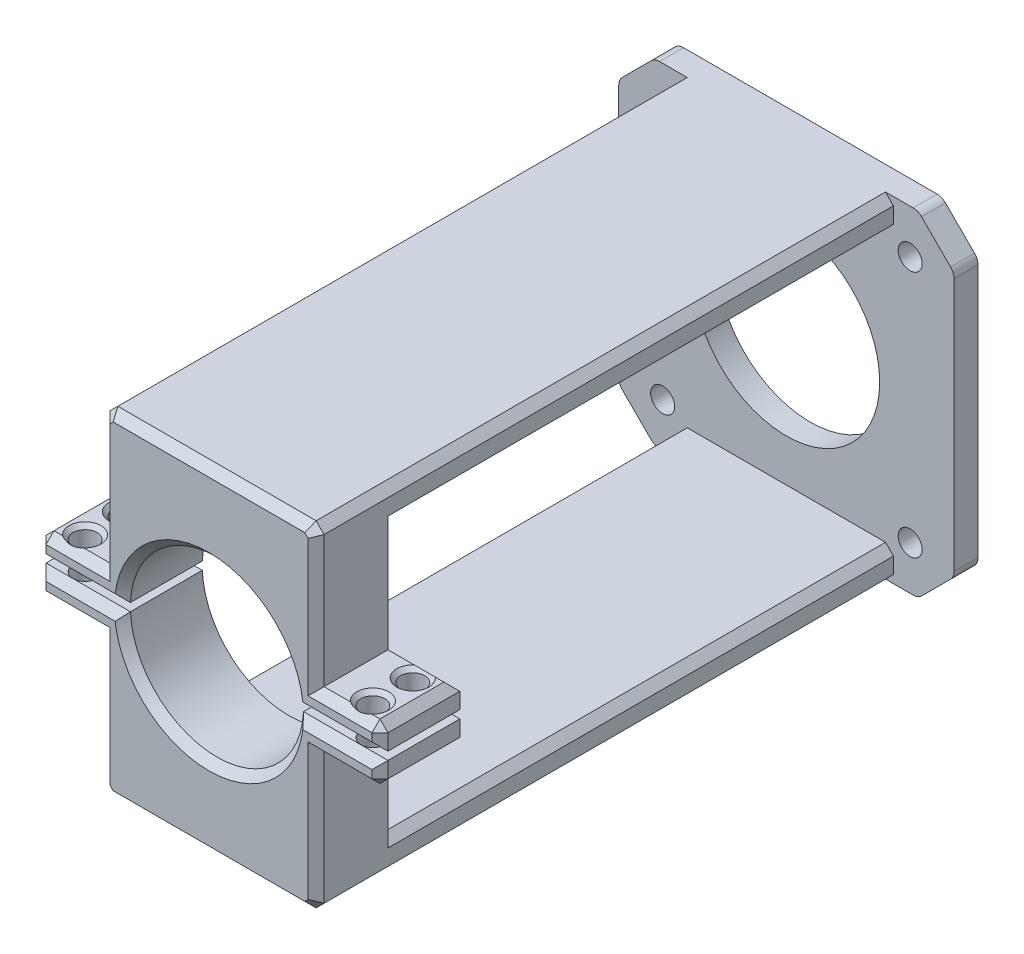
from build123d import *

# Parameters (mm, degrees)
SKETCH1_R                = 1.5
SKETCH1_R_2              = 11.683085131
BOSS_EXTRUDE1_DEPTH      = 3
SKETCH2_W                = 26.83266495
SKETCH2_H                = 4
BOSS_EXTRUDE2_DEPTH      = 70.321471268
BOSS_EXTRUDE3_DEPTH      = 2
BOSS_EXTRUDE3_DEPTH_BACK = 8
SKETCH4_R                = 1.5
CUT_EXTRUDE1_DEPTH       = 20
CHAMFER1_SIZE            = 1
CHAMFER2_SIZE            = 1
CHAMFER3_SIZE            = 1
CHAMFER4_SIZE            = 0.5


# Some blends are built 0.0001 mm under size
with BuildPart() as part:
    # Sketch1 → Boss-Extrude1 (new body)
    with BuildSketch(Plane.XY):
        with BuildLine():
            Line((20.560660172, 16.939339828), (16.939339828, 20.560660172))
            ThreePointArc((16.939339828, 20.560660172), (16.452704805, 20.885819299), (15.878679656, 21))
            Line((15.878679656, 21), (-15.878679656, 21))
            ThreePointArc((-15.878679656, 21), (-16.452704805, 20.885819299), (-16.939339828, 20.560660172))
            Line((-16.939339828, 20.560660172), (-20.560660172, 16.939339828))
            ThreePointArc((-20.560660172, 16.939339828), (-20.885819299, 16.452704805), (-21, 15.878679656))
            Line((-21, 15.878679656), (-21, -15.878679656))
            ThreePointArc((-21, -15.878679656), (-20.885819299, -16.452704805), (-20.560660172, -16.939339828))
            Line((-20.560660172, -16.939339828), (-16.939339828, -20.560660172))
            ThreePointArc((-16.939339828, -20.560660172), (-16.452704805, -20.885819299), (-15.878679656, -21))
            Line((-15.878679656, -21), (15.878679656, -21))
            ThreePointArc((15.878679656, -21), (16.452704805, -20.885819299), (16.939339828, -20.560660172))
            Line((16.939339828, -20.560660172), (20.560660172, -16.939339828))
            ThreePointArc((20.560660172, -16.939339828), (20.885819299, -16.452704805), (21, -15.878679656))
            Line((21, -15.878679656), (21, 15.878679656))
            ThreePointArc((21, 15.878679656), (20.885819299, 16.452704805), (20.560660172, 16.939339828))
        make_face()
        with Locations((-15.5, 15.5)):
            Circle(SKETCH1_R, mode=Mode.SUBTRACT)
        with Locations((15.5, 15.5)):
            Circle(SKETCH1_R, mode=Mode.SUBTRACT)
        with Locations((15.5, -15.5)):
            Circle(SKETCH1_R, mode=Mode.SUBTRACT)
        with Locations((-15.5, -15.5)):
            Circle(SKETCH1_R, mode=Mode.SUBTRACT)
        Circle(SKETCH1_R_2, mode=Mode.SUBTRACT)
    extrude(amount=BOSS_EXTRUDE1_DEPTH)

    # Sketch2 → Boss-Extrude2 (add)
    with BuildSketch(Plane.XY.offset(3)):
        with Locations((0, -19)):
            Rectangle(SKETCH2_W, SKETCH2_H)
        with Locations((0, 19)):
            Rectangle(SKETCH2_W, SKETCH2_H)
    extrude(amount=BOSS_EXTRUDE2_DEPTH)

    # Sketch3 → Boss-Extrude3 (add, two sides: drawn at the far end of the back side and taken through both)
    with BuildSketch(Plane.XY.offset(73.321471268).offset(-BOSS_EXTRUDE3_DEPTH_BACK)):
        with BuildLine():
            Line((21.416332475, 3.5), (13.416332475, 3.5))
            Line((13.416332475, 3.5), (13.416332475, 21))
            Line((13.416332475, 21), (-13.416332475, 21))
            Line((-13.416332475, 21), (-13.416332475, 3.5))
            Line((-13.416332475, 3.5), (-21.416332475, 3.5))
            Line((-21.416332475, 3.5), (-21.416332475, 0.5))
            Line((-21.416332475, 0.5), (-10.837664512, 0.5))
            ThreePointArc((-10.837664512, 0.5), (-7.492675622, 7.846322966), (0, 10.849192231))
            ThreePointArc((0, 10.849192231), (7.492675622, 7.846322966), (10.837664512, 0.5))
            Line((10.837664512, 0.5), (21.416332475, 0.5))
            Line((21.416332475, 0.5), (21.416332475, 3.5))
        make_face()
        with BuildLine():
            Line((-13.416332475, -21), (13.416332475, -21))
            Line((13.416332475, -21), (13.416332475, -3.5))
            Line((13.416332475, -3.5), (21.416332475, -3.5))
            Line((21.416332475, -3.5), (21.416332475, -0.5))
            Line((21.416332475, -0.5), (10.837664512, -0.5))
            ThreePointArc((10.837664512, -0.5), (0, -10.849192231), (-10.837664512, -0.5))
            Line((-10.837664512, -0.5), (-21.416332475, -0.5))
            Line((-21.416332475, -0.5), (-21.416332475, -3.5))
            Line((-21.416332475, -3.5), (-13.416332475, -3.5))
            Line((-13.416332475, -3.5), (-13.416332475, -21))
        make_face()
    extrude(amount=BOSS_EXTRUDE3_DEPTH + BOSS_EXTRUDE3_DEPTH_BACK)

    # Sketch4 → Cut-Extrude1 (cut)
    with BuildSketch(Plane.XZ.offset(3.5)):
        with Locations((-18.023235698, 72.821471268)):
            Circle(SKETCH4_R)
        with Locations((-18.023235698, 67.821471268)):
            Circle(SKETCH4_R)
        with Locations((18.023235698, 72.821471268)):
            Circle(SKETCH4_R)
        with Locations((18.023235698, 67.821471268)):
            Circle(SKETCH4_R)
    extrude(amount=-CUT_EXTRUDE1_DEPTH, mode=Mode.SUBTRACT)

    # Chamfer1
    chamfer1_edges = [part.edges().sort_by_distance(p)[0] for p in [
        (-13.416332475, 17, 34.160735634),
        (13.416332475, 17, 34.160735634),
        (-13.416332475, -21, 39.160735634),
        (13.416332475, -21, 39.160735634),
        (-13.416332475, 21, 39.160735634),
        (13.416332475, 21, 39.160735634),
        (13.416332475, -17, 34.160735634),
        (-13.416332475, -17, 34.160735634),
    ]]
    chamfer(chamfer1_edges, length=CHAMFER1_SIZE)

    # Chamfer2
    chamfer2_edges = [part.edges().sort_by_distance(p)[0] for p in [
        (-17.416332475, -3.5, 75.321471268),
        (-13.416332475, -10.75, 65.321471268),
        (-17.416332475, -3.5, 65.321471268),
        (-21.416332475, -3.5, 70.321471268),
        (-21.416332475, -2, 75.321471268),
        (-16.126998493, -0.5, 75.321471268),
        (0, -10.849192231, 75.321471268),
        (16.126998493, -0.5, 75.321471268),
        (21.416332475, -2, 75.321471268),
        (-13.416332475, -11.75, 75.321471268),
        (-12.916332475, -20.5, 75.321471268),
        (0, -21, 75.321471268),
        (12.916332475, -20.5, 75.321471268),
        (13.416332475, -11.75, 75.321471268),
        (17.416332475, -3.5, 75.321471268),
        (17.416332475, -3.5, 65.321471268),
        (21.416332475, -3.5, 70.321471268),
        (17.416332475, 3.5, 75.321471268),
        (17.416332475, 3.5, 65.321471268),
        (21.416332475, 3.5, 70.321471268),
        (21.416332475, 2, 75.321471268),
        (16.126998493, 0.5, 75.321471268),
        (0, 10.849192231, 75.321471268),
        (-16.126998493, 0.5, 75.321471268),
        (-21.416332475, 2, 75.321471268),
        (-13.416332475, 10.75, 65.321471268),
        (-17.416332475, 3.5, 65.321471268),
        (-21.416332475, 3.5, 70.321471268),
        (-17.416332475, 3.5, 75.321471268),
        (-13.416332475, 11.75, 75.321471268),
        (-12.916332475, 20.5, 75.321471268),
        (13.416332475, 11.75, 75.321471268),
        (12.916332475, 20.5, 75.321471268),
        (0, 21, 75.321471268),
    ]]
    chamfer(chamfer2_edges, length=CHAMFER2_SIZE - 0.0001)  # a hair under: the kernel refuses the full size

    # Chamfer3
    chamfer3_edges = [part.edges().sort_by_distance(p)[0] for p in [
        (13.416332475, 10.25005, 65.321471268),
        (13.416332475, -10.25005, 65.321471268),
    ]]
    chamfer(chamfer3_edges, length=CHAMFER3_SIZE)

    # Chamfer4
    # the kernel refuses this chamfer: 0.5 mm, written as the material it takes off along each edge
    with BuildSketch(Plane(origin=(-18.023235698, 3.5, 67.821471268), x_dir=(1, 0, 0), z_dir=(0, 0, -1))) as chamfer4_piece_1:
        Polygon((1.5, CHAMFER4_SIZE), (1.5 + CHAMFER4_SIZE, 0), (1.5, 0), align=None)
    revolve(axis=Axis((-18.023235698, 3.5, 67.821471268), (0, -1, 0)), mode=Mode.SUBTRACT)
    with BuildSketch(Plane(origin=(-18.023235698, -3.5, 67.821471268), x_dir=(1, 0, 0), z_dir=(0, 0, -1))) as chamfer4_piece_2:
        Polygon((1.5 + CHAMFER4_SIZE, 0), (1.5, -CHAMFER4_SIZE), (1.5, 0), align=None)
    revolve(axis=Axis((-18.023235698, -3.5, 67.821471268), (0, -1, 0)), mode=Mode.SUBTRACT)
    with BuildSketch(Plane(origin=(18.023235698, -3.5, 72.821471268), x_dir=(1, 0, 0), z_dir=(0, 0, -1))) as chamfer4_piece_3:
        Polygon((1.5 + CHAMFER4_SIZE, 0), (1.5, -CHAMFER4_SIZE), (1.5, 0), align=None)
    revolve(axis=Axis((18.023235698, -3.5, 72.821471268), (0, -1, 0)), mode=Mode.SUBTRACT)
    with BuildSketch(Plane(origin=(18.023235698, 3.5, 72.821471268), x_dir=(1, 0, 0), z_dir=(0, 0, -1))) as chamfer4_piece_4:
        Polygon((1.5 + CHAMFER4_SIZE, 0), (1.5, CHAMFER4_SIZE), (1.5, 0), align=None)
    revolve(axis=Axis((18.023235698, 3.5, 72.821471268), (0, -1, 0)), mode=Mode.SUBTRACT)
    with BuildSketch(Plane(origin=(18.023235698, -3.5, 67.821471268), x_dir=(1, 0, 0), z_dir=(0, 0, -1))) as chamfer4_piece_5:
        Polygon((1.5 + CHAMFER4_SIZE, 0), (1.5, -CHAMFER4_SIZE), (1.5, 0), align=None)
    revolve(axis=Axis((18.023235698, -3.5, 67.821471268), (0, -1, 0)), mode=Mode.SUBTRACT)
    with BuildSketch(Plane(origin=(18.023235698, 3.5, 67.821471268), x_dir=(1, 0, 0), z_dir=(0, 0, -1))) as chamfer4_piece_6:
        Polygon((1.5 + CHAMFER4_SIZE, 0), (1.5, CHAMFER4_SIZE), (1.5, 0), align=None)
    revolve(axis=Axis((18.023235698, 3.5, 67.821471268), (0, -1, 0)), mode=Mode.SUBTRACT)
    with BuildSketch(Plane(origin=(-18.023235698, 3.5, 72.821471268), x_dir=(1, 0, 0), z_dir=(0, 0, -1))) as chamfer4_piece_7:
        Polygon((1.5, CHAMFER4_SIZE), (1.5 + CHAMFER4_SIZE, 0), (1.5, 0), align=None)
    revolve(axis=Axis((-18.023235698, 3.5, 72.821471268), (0, -1, 0)), mode=Mode.SUBTRACT)
    with BuildSketch(Plane(origin=(-18.023235698, -3.5, 72.821471268), x_dir=(1, 0, 0), z_dir=(0, 0, -1))) as chamfer4_piece_8:
        Polygon((1.5 + CHAMFER4_SIZE, 0), (1.5, -CHAMFER4_SIZE), (1.5, 0), align=None)
    revolve(axis=Axis((-18.023235698, -3.5, 72.821471268), (0, -1, 0)), mode=Mode.SUBTRACT)


solid = part.part
